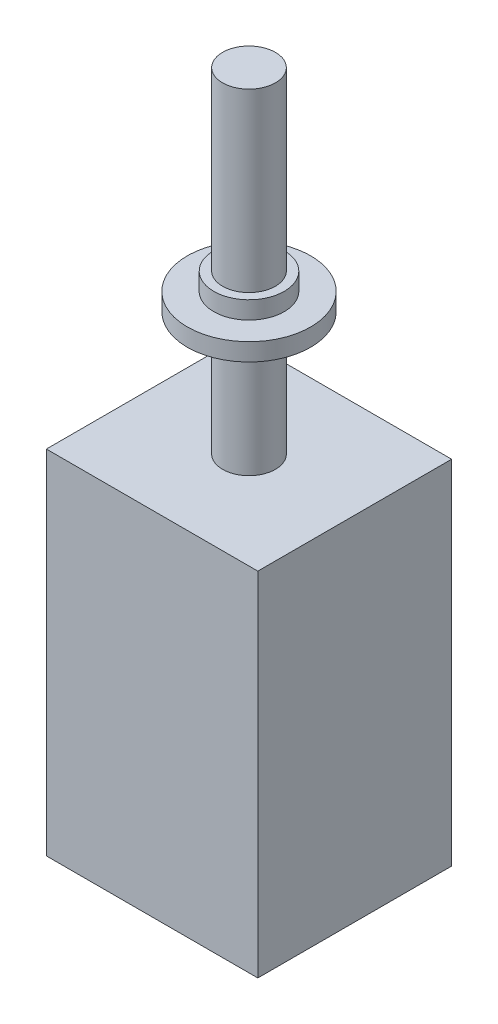
from build123d import *

# Parameters (mm, degrees)
SKETCH1_W           = 12
SKETCH1_H           = 11
BOSS_EXTRUDE1_DEPTH = 20
SKETCH2_R           = 1.5
BOSS_EXTRUDE2_DEPTH = 19
SKETCH3_R           = 3.5
BOSS_EXTRUDE3_DEPTH = 1
SKETCH4_R           = 2
BOSS_EXTRUDE4_DEPTH = 1


with BuildPart() as part:
    # Sketch1 → Boss-Extrude1 (new body)
    with BuildSketch(Plane(origin=(0, 0, 0), x_dir=(1, 0, 0), z_dir=(0, 1, 0))):
        with Locations((6, 5.5)):
            Rectangle(SKETCH1_W, SKETCH1_H)
    extrude(amount=BOSS_EXTRUDE1_DEPTH)

    # Sketch2 → Boss-Extrude2 (add)
    with BuildSketch(Plane(origin=(0, 20, 0), x_dir=(1, 0, 0), z_dir=(0, 1, 0))):
        with Locations((6, 5.5)):
            Circle(SKETCH2_R)
    extrude(amount=BOSS_EXTRUDE2_DEPTH)

    # Sketch3 → Boss-Extrude3 (add)
    with BuildSketch(Plane(origin=(0, 27, 0), x_dir=(1, 0, 0), z_dir=(0, 1, 0))):
        with Locations((6, 5.5)):
            Circle(SKETCH3_R)
    extrude(amount=BOSS_EXTRUDE3_DEPTH)

    # Sketch4 → Boss-Extrude4 (add)
    with BuildSketch(Plane(origin=(0, 28, 0), x_dir=(1, 0, 0), z_dir=(0, 1, 0))):
        with Locations((6, 5.5)):
            Circle(SKETCH4_R)
    extrude(amount=BOSS_EXTRUDE4_DEPTH)


solid = part.part
